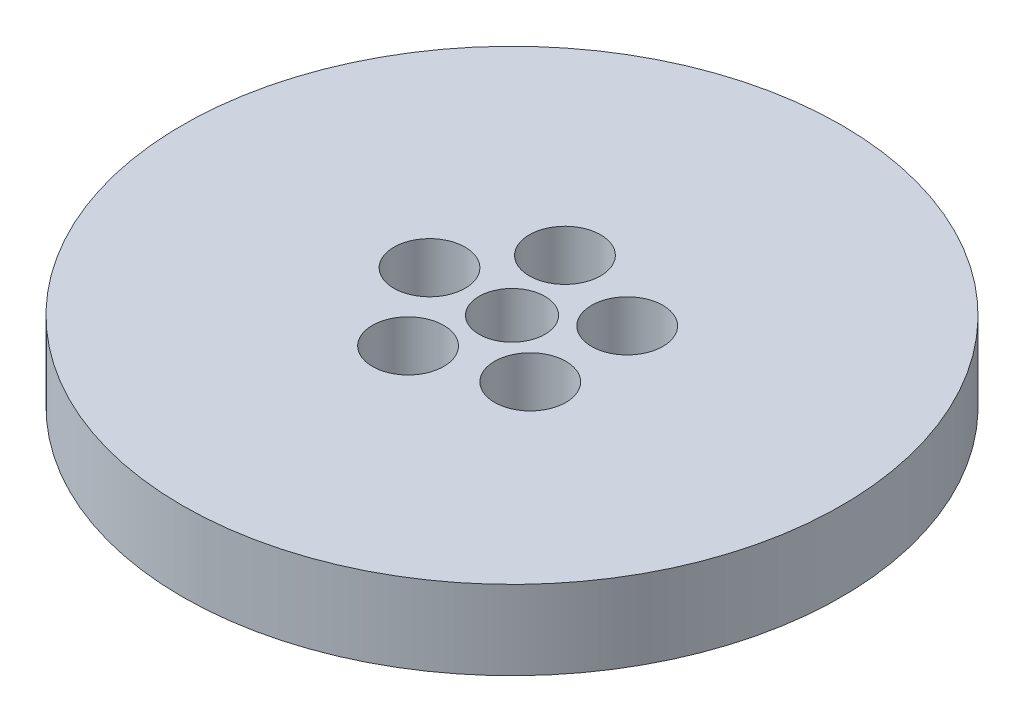
from build123d import *

# Parameters (mm, degrees)
SKETCH1_R           = 50
BOSS_EXTRUDE1_DEPTH = 12
SKETCH2_R           = 5
CUT_EXTRUDE1_DEPTH  = 72.721684308
SKETCH3_R           = 5.410062526
CUT_EXTRUDE2_DEPTH  = 11.799118227
CIRPATTERN1_COUNT   = 5


with BuildPart() as part:
    # Sketch1 → Boss-Extrude1 (new body)
    with BuildSketch(Plane(origin=(0, 0, 0), x_dir=(1, 0, 0), z_dir=(0, 1, 0))):
        Circle(SKETCH1_R)
    extrude(amount=BOSS_EXTRUDE1_DEPTH)

    # Sketch2 → Cut-Extrude1 (cut, through all)
    with BuildSketch(Plane(origin=(0, 0, 0), x_dir=(1, 0, 0), z_dir=(0, 1, 0))):
        Circle(SKETCH2_R)
    extrude(amount=CUT_EXTRUDE1_DEPTH, mode=Mode.SUBTRACT)

    # Sketch3 → Cut-Extrude2 (cut)
    with BuildSketch(Plane(origin=(0, 12, 0), x_dir=(1, 0, 0), z_dir=(0, 1, 0))):
        with Locations((-12.513944473, 0)):
            Circle(SKETCH3_R)
    cut_extrude2 = extrude(amount=-CUT_EXTRUDE2_DEPTH, mode=Mode.SUBTRACT)

    # CirPattern1: Cut-Extrude2 ×5 about axis
    cirpattern1_axis = Axis((0, 0, 0), (0, 1, 0))
    for i in range(1, CIRPATTERN1_COUNT):
        add(cut_extrude2.rotate(cirpattern1_axis, i * 360 / CIRPATTERN1_COUNT), mode=Mode.SUBTRACT)


solid = part.part
